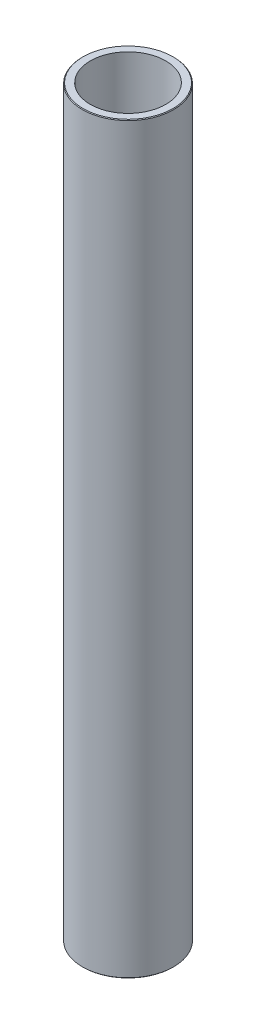
from build123d import *

# Parameters (mm, degrees)
SKETCH1_R           = 32.5
BOSS_EXTRUDE1_DEPTH = 530.269863305
SKETCH2_R           = 26.914250085
CUT_EXTRUDE1_DEPTH  = 533.258046374
CHAMFER1_SIZE       = 0.474449832


with BuildPart() as part:
    # Sketch1 → Boss-Extrude1 (new body)
    with BuildSketch(Plane(origin=(0, 0, 0), x_dir=(1, 0, 0), z_dir=(0, 1, 0))):
        Circle(SKETCH1_R)
    extrude(amount=BOSS_EXTRUDE1_DEPTH)

    # Sketch2 → Cut-Extrude1 (cut, through all)
    with BuildSketch(Plane(origin=(0, 0, 0), x_dir=(1, 0, 0), z_dir=(0, 1, 0))):
        Circle(SKETCH2_R)
    extrude(amount=CUT_EXTRUDE1_DEPTH, mode=Mode.SUBTRACT)

    # Chamfer1
    chamfer1_edges = [part.edges().sort_by_distance(p)[0] for p in [
        (-32.5, 530.269863305, 0),
        (-32.5, 0, 0),
    ]]
    chamfer(chamfer1_edges, length=CHAMFER1_SIZE)


solid = part.part
